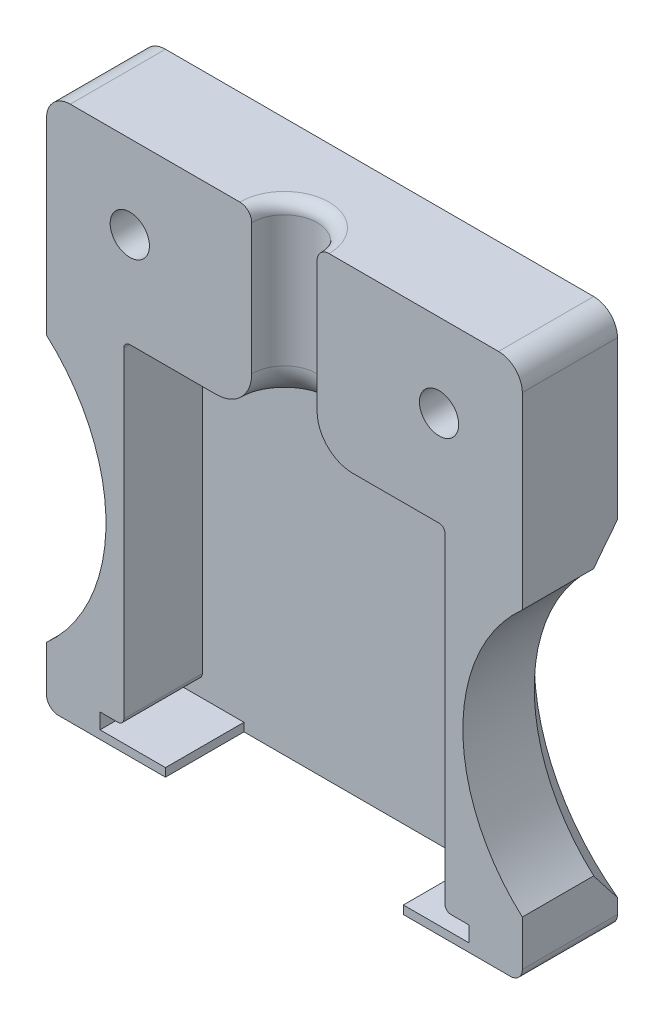
from build123d import *

# Parameters (mm, degrees)
CROQUIS1_W              = 40
CROQUIS1_H              = 45
SALIENTE_EXTRUIR1_DEPTH = 8
CROQUIS2_W              = 31
CROQUIS2_H              = 1.3
CORTAR_EXTRUIR1_DEPTH   = 6.6
CROQUIS3_R              = 15
CORTAR_EXTRUIR2_DEPTH   = 10
CHAFL_N1_SIZE           = 2
CROQUIS4_W              = 27
CROQUIS4_H              = 28
CORTAR_EXTRUIR3_DEPTH   = 6.6
CROQUIS6_R              = 2.75
CORTAR_EXTRUIR4_DEPTH   = 16.6
CROQUIS7_R              = 1.65
CORTAR_EXTRUIR5_DEPTH   = 16.6
CROQUIS8_R              = 4
CORTAR_EXTRUIR6_DEPTH   = 4
CROQUIS9_W              = 20
CROQUIS9_H              = 6.6
CORTAR_EXTRUIR7_DEPTH   = 4
REDONDEO1_R             = 1
REDONDEO2_R             = 2
REDONDEO3_R             = 1
REDONDEO4_R             = 3
REDONDEO5_R             = 0.5
REDONDEO6_R             = 0.5


with BuildPart() as part:
    # Croquis1 → Saliente-Extruir1 (new body)
    with BuildSketch(Plane.XY):
        Rectangle(CROQUIS1_W, CROQUIS1_H)
    extrude(amount=SALIENTE_EXTRUIR1_DEPTH)

    # Croquis2 → Cortar-Extruir1 (cut)
    with BuildSketch(Plane.XY.offset(8)):
        with Locations((0, -21.15)):
            Rectangle(CROQUIS2_W, CROQUIS2_H)
    extrude(amount=-CORTAR_EXTRUIR1_DEPTH, mode=Mode.SUBTRACT)

    # Croquis3 → Cortar-Extruir2 (cut)
    with BuildSketch(Plane.XY.offset(8)):
        with Locations((-30, -6.5)):
            Circle(CROQUIS3_R)
        with Locations((30, -6.5)):
            Circle(CROQUIS3_R)
    extrude(amount=-CORTAR_EXTRUIR2_DEPTH, mode=Mode.SUBTRACT)

    # Chaflán1
    chafl_n1_edges = [part.edges().sort_by_distance(p)[0] for p in [
        (15, -6.5, 0),
        (-15, -6.5, 0),
    ]]
    chamfer(chafl_n1_edges, length=CHAFL_N1_SIZE)

    # Croquis4 → Cortar-Extruir3 (cut)
    with BuildSketch(Plane.XY.offset(8)):
        with Locations((0, -6.5)):
            Rectangle(CROQUIS4_W, CROQUIS4_H)
    extrude(amount=-CORTAR_EXTRUIR3_DEPTH, mode=Mode.SUBTRACT)

    # Croquis6 → Cortar-Extruir4 (cut)
    with BuildSketch(Plane(origin=(0, 22.5, 0), x_dir=(1, 0, 0), z_dir=(0, 1, 0))):
        with Locations((0, -8)):
            Circle(CROQUIS6_R)
    extrude(amount=-CORTAR_EXTRUIR4_DEPTH, mode=Mode.SUBTRACT)

    # Croquis7 → Cortar-Extruir5 (cut)
    with BuildSketch(Plane.XY.offset(8)):
        with Locations((13, 15.5)):
            Circle(CROQUIS7_R)
        with Locations((-13, 15.5)):
            Circle(CROQUIS7_R)
    extrude(amount=-CORTAR_EXTRUIR5_DEPTH, mode=Mode.SUBTRACT)

    # Croquis8 → Cortar-Extruir6 (cut)
    with BuildSketch(Plane(origin=(0, 0, 0), x_dir=(-1, 0, 0), z_dir=(0, 0, -1))):
        with Locations((13, 15.5)):
            Circle(CROQUIS8_R)
        with Locations((-13, 15.5)):
            Circle(CROQUIS8_R)
    extrude(amount=-CORTAR_EXTRUIR6_DEPTH, mode=Mode.SUBTRACT)

    # Croquis9 → Cortar-Extruir7 (cut)
    with BuildSketch(Plane(origin=(0, -22.5, 0), x_dir=(-1, 0, 0), z_dir=(0, -1, 0))):
        with Locations((0, -4.7)):
            Rectangle(CROQUIS9_W, CROQUIS9_H)
    extrude(amount=-CORTAR_EXTRUIR7_DEPTH, mode=Mode.SUBTRACT)

    # Redondeo1
    redondeo1_edges = [part.edges().sort_by_distance(p)[0] for p in [
        (0, 22.5, 5.25),
    ]]
    fillet(redondeo1_edges, radius=REDONDEO1_R)

    # Redondeo2
    redondeo2_edges = [part.edges().sort_by_distance(p)[0] for p in [
        (20, 22.5, 4),
        (-20, 22.5, 4),
    ]]
    fillet(redondeo2_edges, radius=REDONDEO2_R)

    # Redondeo3
    redondeo3_edges = [part.edges().sort_by_distance(p)[0] for p in [
        (20, -22.5, 4),
        (-20, -22.5, 4),
    ]]
    fillet(redondeo3_edges, radius=REDONDEO3_R)

    # Redondeo4
    redondeo4_edges = [part.edges().sort_by_distance(p)[0] for p in [
        (0, 7.5, 5.25),
    ]]
    fillet(redondeo4_edges, radius=REDONDEO4_R)

    # Redondeo5
    redondeo5_edges = [part.edges().sort_by_distance(p)[0] for p in [
        (-13.5, -20.5, 4.7),
        (13.5, -20.5, 4.7),
    ]]
    fillet(redondeo5_edges, radius=REDONDEO5_R)

    # Redondeo6
    redondeo6_edges = [part.edges().sort_by_distance(p)[0] for p in [
        (13.5, 7.5, 4.7),
        (-13.5, 7.5, 4.7),
    ]]
    fillet(redondeo6_edges, radius=REDONDEO6_R)


solid = part.part
